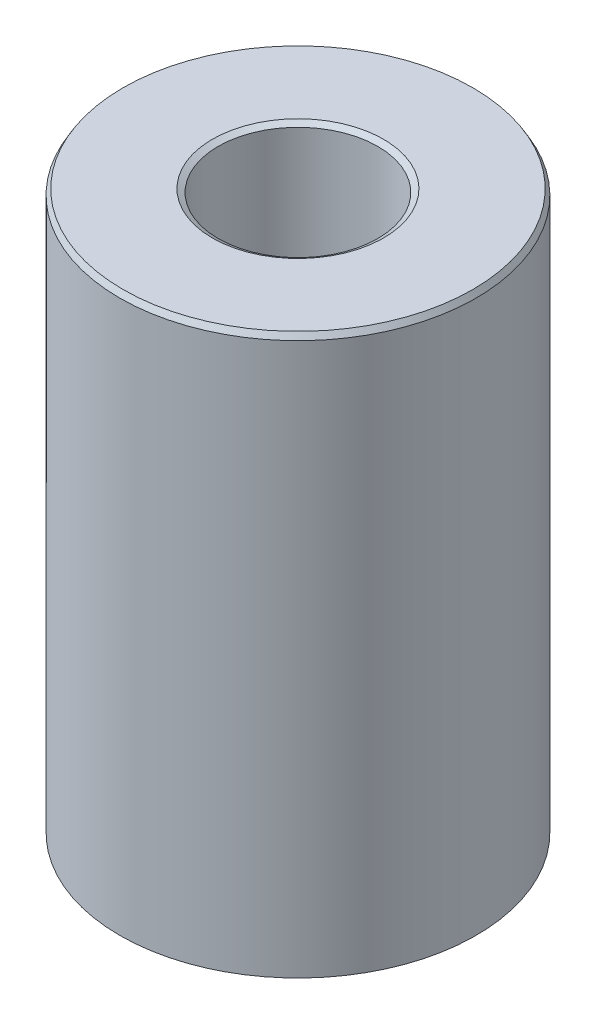
from build123d import *
from OCP.BRepFilletAPI import BRepFilletAPI_MakeChamfer

# Parameters (mm, degrees)
SKETCH1_R           = 55
BOSS_EXTRUDE1_DEPTH = 173.214914338
SKETCH2_R           = 24.64888682
CUT_EXTRUDE1_DEPTH  = 190.877346066
CHAMFER1_SIZE       = 1.774892489
CHAMFER1_SIZE2      = 1.024734656


with BuildPart() as part:
    # Sketch1 → Boss-Extrude1 (new body)
    with BuildSketch(Plane(origin=(0, 0, 0), x_dir=(1, 0, 0), z_dir=(0, 1, 0))):
        Circle(SKETCH1_R)
    extrude(amount=BOSS_EXTRUDE1_DEPTH)

    # Sketch2 → Cut-Extrude1 (cut, through all)
    with BuildSketch(Plane(origin=(0, 0, 0), x_dir=(1, 0, 0), z_dir=(0, 1, 0))):
        Circle(SKETCH2_R)
    extrude(amount=CUT_EXTRUDE1_DEPTH, mode=Mode.SUBTRACT)

    # Chamfer1: one chamfer whose edges measure the first distance from different faces: ONE call of the kernel's chamfer builder (chamfer() names one face for all edges)
    chamfer1_edges_1 = [part.edges().sort_by_distance(p)[0] for p in [
        (-24.64888682, 173.214914338, 0),
    ]]
    chamfer1_side_1 = [part.faces().sort_by_distance(p)[0] for p in [
        (-53.444365081, 173.214914338, 0),
    ]]
    chamfer1_edges_2 = [part.edges().sort_by_distance(p)[0] for p in [
        (-24.64888682, 0, 0),
    ]]
    chamfer1_side_2 = [part.faces().sort_by_distance(p)[0] for p in [
        (-24.64888682, 86.607457169, 0),
    ]]
    chamfer1_edges_3 = [part.edges().sort_by_distance(p)[0] for p in [
        (-55, 0, 0),
    ]]
    chamfer1_side_3 = [part.faces().sort_by_distance(p)[0] for p in [
        (-53.444365081, 0, 0),
    ]]
    chamfer1_edges_4 = [part.edges().sort_by_distance(p)[0] for p in [
        (-55, 173.214914338, 0),
    ]]
    chamfer1_side_4 = [part.faces().sort_by_distance(p)[0] for p in [
        (-55, 86.607457169, 0),
    ]]
    chamfer1 = BRepFilletAPI_MakeChamfer(part.part.solid().wrapped)
    for e in chamfer1_edges_1:
        chamfer1.Add(CHAMFER1_SIZE, CHAMFER1_SIZE2, e.wrapped, chamfer1_side_1[0].wrapped)  # the first distance lies on this face
    for e in chamfer1_edges_2:
        chamfer1.Add(CHAMFER1_SIZE, CHAMFER1_SIZE2, e.wrapped, chamfer1_side_2[0].wrapped)  # the first distance lies on this face
    for e in chamfer1_edges_3:
        chamfer1.Add(CHAMFER1_SIZE, CHAMFER1_SIZE2, e.wrapped, chamfer1_side_3[0].wrapped)  # the first distance lies on this face
    for e in chamfer1_edges_4:
        chamfer1.Add(CHAMFER1_SIZE, CHAMFER1_SIZE2, e.wrapped, chamfer1_side_4[0].wrapped)  # the first distance lies on this face
    add(Compound.cast(chamfer1.Shape()), mode=Mode.REPLACE)


solid = part.part
